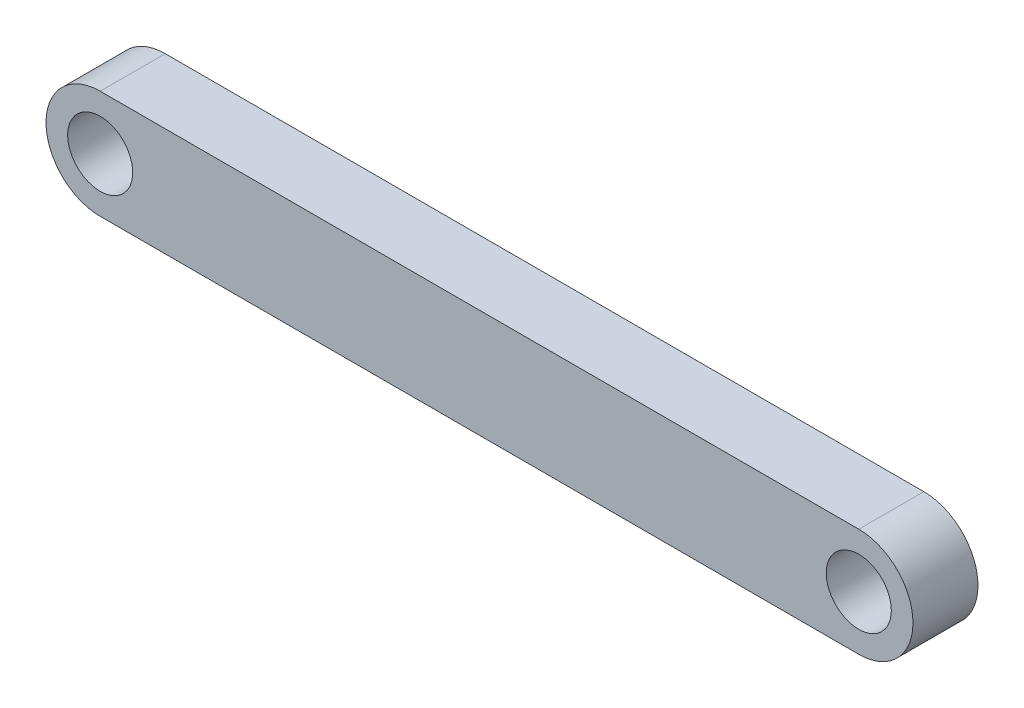
from build123d import *

# Parameters (mm, degrees)
AUFSATZ_LINEAR_AUSTRAGEN1_DEPTH      = 3
AUFSATZ_LINEAR_AUSTRAGEN1_DEPTH_BACK = 3
SKIZZE2_R                            = 3


with BuildPart() as part:
    # Skizze2 → Aufsatz-Linear austragen1 (new, two sides: drawn at the far end of the back side and taken through both)
    with BuildSketch(Plane.XY.offset(-AUFSATZ_LINEAR_AUSTRAGEN1_DEPTH_BACK)):
        with BuildLine():
            Line((0, 675), (70, 675))
            ThreePointArc((70, 675), (75, 670), (70, 665))
            Line((70, 665), (0, 665))
            ThreePointArc((0, 665), (-5, 670), (0, 675))
        make_face()
        with Locations((0, 670)):
            Circle(SKIZZE2_R, mode=Mode.SUBTRACT)
        with Locations((70, 670)):
            Circle(SKIZZE2_R, mode=Mode.SUBTRACT)
    extrude(amount=AUFSATZ_LINEAR_AUSTRAGEN1_DEPTH + AUFSATZ_LINEAR_AUSTRAGEN1_DEPTH_BACK)


solid = part.part
